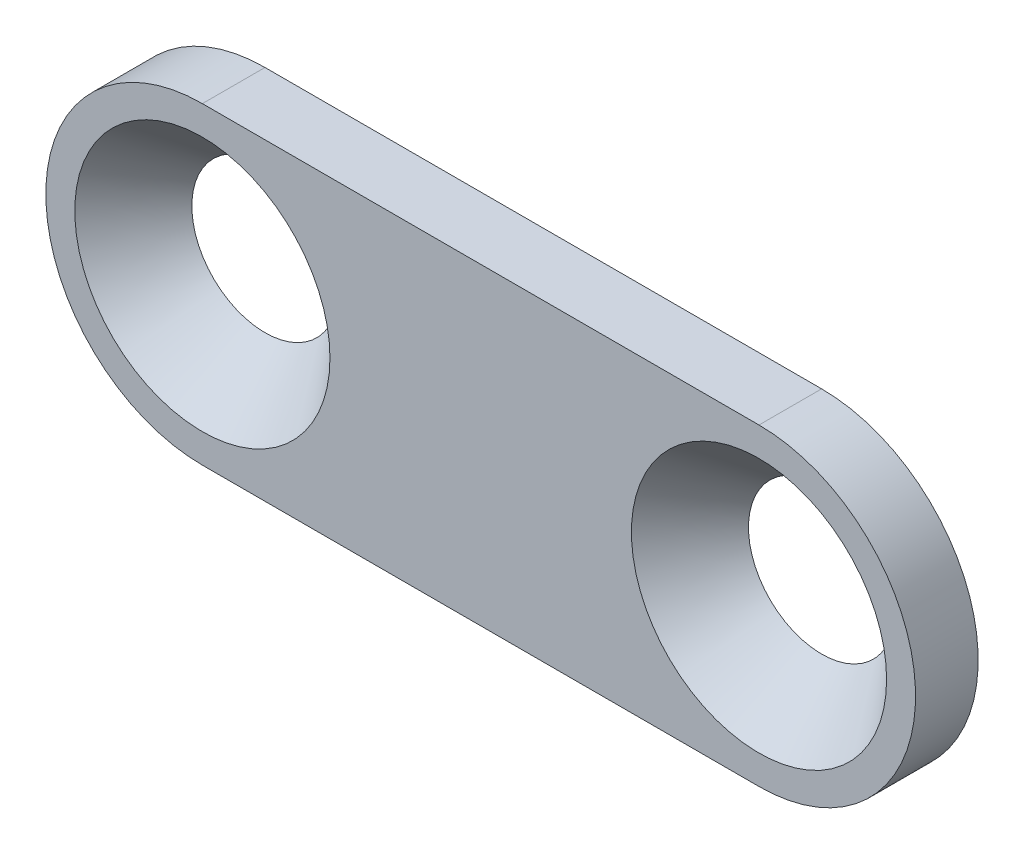
from build123d import *

# Parameters (mm, degrees)
BASE_FLANGE1_DEPTH                            = 2.286
CSK_FOR_8_FLAT_HEAD_MACHINE_SCREW1_AT_2_COUNT = 2
CSK_FOR_8_FLAT_HEAD_MACHINE_SCREW1_AT_2_PITCH = 20.32


# Sheet-metal steps are written as plain solids
with BuildPart() as part:
    # Sketch1 → Base-Flange1 (new body)
    with BuildSketch(Plane.XY):
        with BuildLine():
            Line((10.16, -5.715), (-10.16, -5.715))
            ThreePointArc((-10.16, -5.715), (-15.875, 0), (-10.16, 5.715))
            Line((-10.16, 5.715), (10.16, 5.715))
            ThreePointArc((10.16, 5.715), (15.875, 0), (10.16, -5.715))
        make_face()
    extrude(amount=-BASE_FLANGE1_DEPTH)

    # Sketch4 → CSK for #8 Flat Head Machine Screw1 (revolve, cut)
    with BuildSketch(Plane(origin=(-10.16, 0, 0), x_dir=(0, -1, 0), z_dir=(1, 0, 0))):
        Polygon((0, 0), (0, 2.286), (2.2479, 2.286), (2.2479, 2.77249335), (4.6579917, 0), align=None)
    csk_for_8_flat_head_machine_screw1 = revolve(axis=Axis((-10.16, 0, 6.35), (0, 0, -1)), mode=Mode.SUBTRACT)

    # CSK for #8 Flat Head Machine Screw1 at 2: CSK for #8 Flat Head Machine Screw1 ×2
    with Locations(*[(i * CSK_FOR_8_FLAT_HEAD_MACHINE_SCREW1_AT_2_PITCH, 0, 0) for i in range(1, CSK_FOR_8_FLAT_HEAD_MACHINE_SCREW1_AT_2_COUNT)]):
        add(csk_for_8_flat_head_machine_screw1, mode=Mode.SUBTRACT)


solid = part.part
